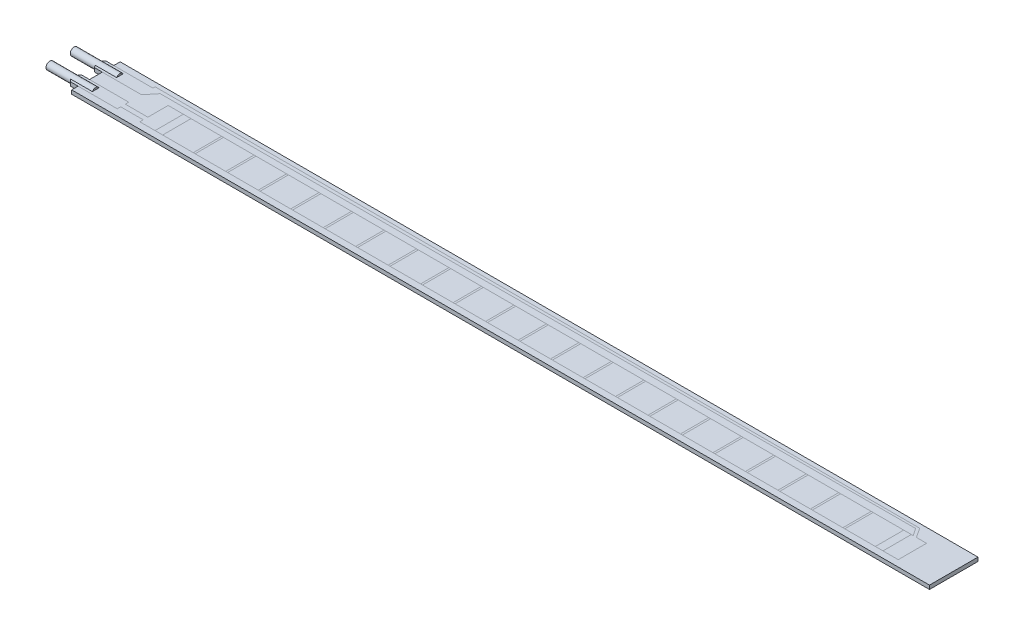
from build123d import *

# Parameters (mm, degrees)
SKETCH1_W                = 112.24
SKETCH1_H                = 6.35
BOSS_EXTRUDE1_DEPTH      = 0.5
BOSS_EXTRUDE2_DEPTH      = 0.5
BOSS_EXTRUDE3_DEPTH      = 3
BOSS_EXTRUDE3_DEPTH_BACK = 3
SKETCH6_R                = 0.5


with BuildPart() as part:
    # Sketch1 → Boss-Extrude1 (new body)
    with BuildSketch(Plane(origin=(0, 0, 0), x_dir=(1, 0, 0), z_dir=(0, 1, 0))):
        Rectangle(SKETCH1_W, SKETCH1_H)
    extrude(amount=BOSS_EXTRUDE1_DEPTH)

    # Sketch5 → Boss-Extrude2 (add)
    with BuildSketch(Plane(origin=(0, 0.5, 0), x_dir=(1, 0, 0), z_dir=(0, 1, 0))):
        Polygon((-56.12, -2.3375), (-57.133154991, -2.3375), (-57.563090459, -1.822005201), (-57.563090459, -1.352994799), (-57.133154991, -0.8375), (-56.12, -0.8375), align=None)
        Polygon((-57.563090459, 1.352994799), (-57.563090459, 1.822005201), (-57.133154991, 2.3375), (-56.12, 2.3375), (-56.12, 0.8375), (-57.133154991, 0.8375), align=None)
    extrude(amount=-BOSS_EXTRUDE2_DEPTH)

    # Sketch6 → Boss-Extrude3 (add, two sides: drawn at the far end of the back side and taken through both)
    with BuildSketch(Plane.ZY.offset(57.563090459).offset(-BOSS_EXTRUDE3_DEPTH_BACK)):
        with Locations((1.5875, 0.25)):
            Circle(SKETCH6_R)
        with Locations((-1.5875, 0.25)):
            Circle(SKETCH6_R)
    extrude(amount=BOSS_EXTRUDE3_DEPTH + BOSS_EXTRUDE3_DEPTH_BACK)


solid = part.part
